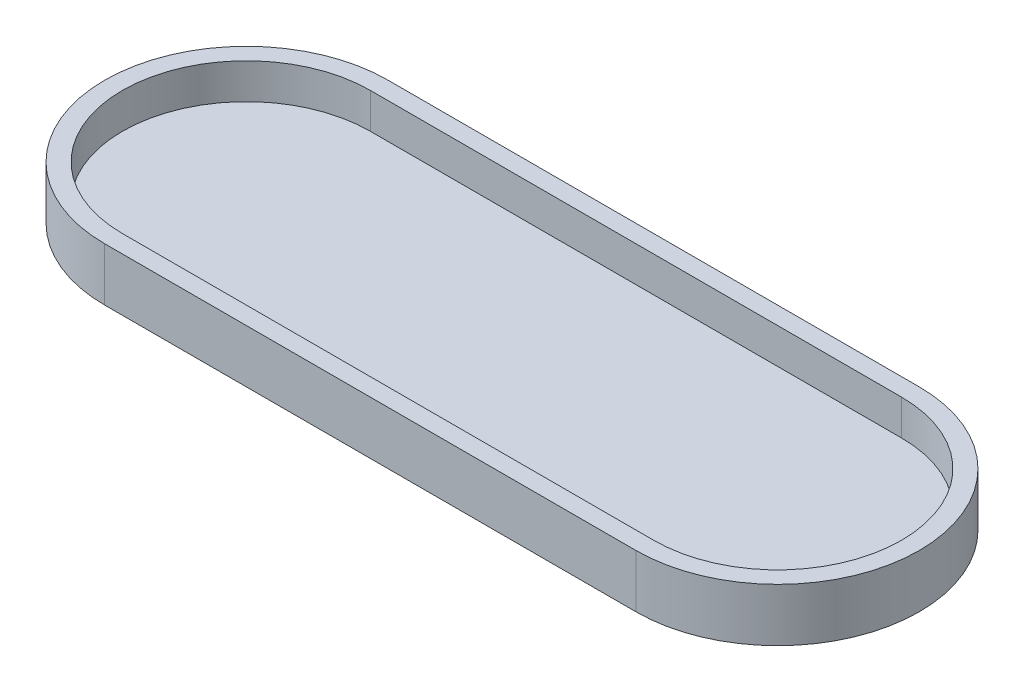
from build123d import *

# Parameters (mm, degrees)
BOSS_EXTRUDE1_DEPTH = 30
BOSS_EXTRUDE2_START = -20
BOSS_EXTRUDE2_DEPTH = 20


# Read off the part's stored shape, not the designer's step: Boss-Extrude2
with BuildPart() as part:
    # Sketch1 → Boss-Extrude1 (new body)
    with BuildSketch(Plane(origin=(0, 0, 0), x_dir=(1, 0, 0), z_dir=(0, 1, 0))):
        with BuildLine():
            Line((0, 80), (300, 80))
            ThreePointArc((300, 80), (380, 0), (300, -80))
            Line((300, -80), (0, -80))
            ThreePointArc((0, -80), (-80, 0), (0, 80))
        make_face()
    extrude(amount=BOSS_EXTRUDE1_DEPTH)

    # Boss-Extrude2 outline → Boss-Extrude2 (cut)
    with BuildSketch(Plane(origin=(0, 30, 0), x_dir=(1, 0, 0), z_dir=(0, 1, 0)).offset(BOSS_EXTRUDE2_START)):
        with BuildLine():
            Line((0, -70), (300, -70))
            ThreePointArc((300, -70), (370, 0), (300, 70))
            Line((300, 70), (0, 70))
            ThreePointArc((0, 70), (-70, 0), (0, -70))
        make_face()
    extrude(amount=BOSS_EXTRUDE2_DEPTH, mode=Mode.SUBTRACT)


solid = part.part
